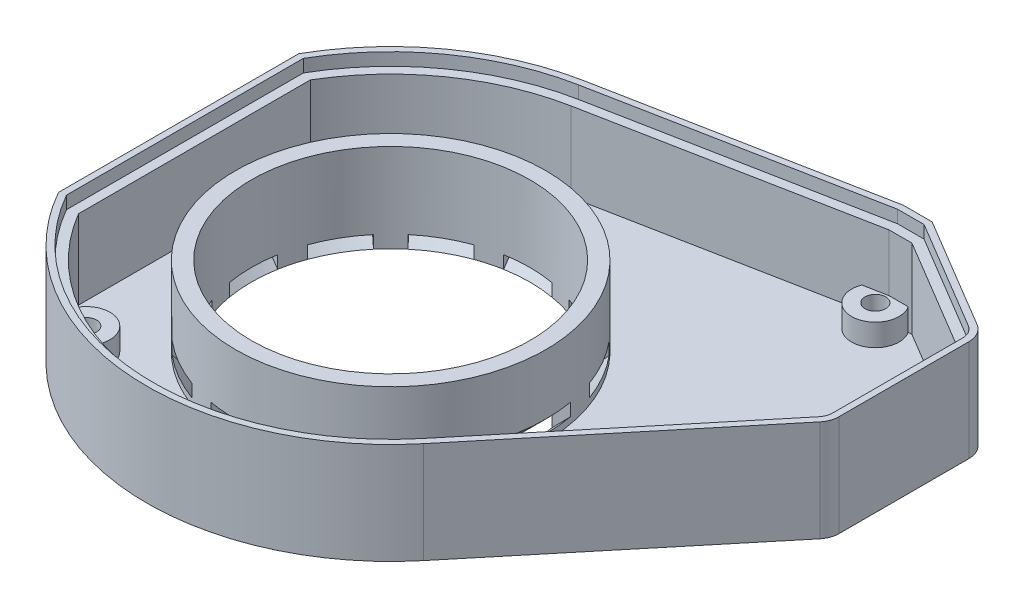
from build123d import *

# Parameters (mm, degrees)
SKETCH3_R                                         = 22
BOSS_EXTRUDE1_DEPTH                               = 1.5
BOSS_EXTRUDE2_DEPTH                               = 12.5
SKETCH5_R                                         = 24.5
SKETCH5_R_2                                       = 22
BOSS_EXTRUDE3_DEPTH                               = 12.5
BOSS_EXTRUDE5_DEPTH                               = 2
CUT_REVOLVE1_ANGLE                                = 20
CIRPATTERN1_COUNT                                 = 12
SKETCH12_R                                        = 3.75
BOSS_EXTRUDE6_DEPTH                               = 5
CSK_FOR_4_FLAT_HEAD_MACHINE_SCREW_100_D           = 3.2639
CSK_FOR_4_FLAT_HEAD_MACHINE_SCREW_100_CSINK_D     = 5.715
CSK_FOR_4_FLAT_HEAD_MACHINE_SCREW_100_CSINK_ANGLE = 100


# Read off the part's stored shape, not the designer's step: Cut-Revolve1
with BuildPart() as part:
    # Sketch3 → Boss-Extrude1 (new body)
    with BuildSketch(Plane(origin=(0, 0, 0), x_dir=(1, 0, 0), z_dir=(0, 1, 0))):
        with BuildLine():
            Line((39.523027355, 46), (34.965412665, 46))
            Line((34.965412665, 46), (-7.331355166, 37.795518669))
            ThreePointArc((-7.331355166, 37.795518669), (-22.480334206, 31.255152759), (-33.5, 18.973665961))
            Line((-33.5, 18.973665961), (-33.5, -18.973665961))
            ThreePointArc((-33.5, -18.973665961), (-3.369315914, -38.35228429), (29.67865128, -24.524022064))
            Line((29.67865128, -24.524022064), (58.016889207, 9.770543449))
            ThreePointArc((58.016889207, 9.770543449), (58.612248226, 10.815349677), (58.81883, 12))
            Line((58.81883, 12), (58.81883, 32.5))
            ThreePointArc((58.81883, 32.5), (58.362392683, 34.228214743), (57.112129316, 35.505674228))
            Line((57.112129316, 35.505674228), (39.523027355, 46))
        make_face()
        with Locations(Location((0, 0, 0), (0, 0, 270))):
            Circle(SKETCH3_R, mode=Mode.SUBTRACT)
    extrude(amount=BOSS_EXTRUDE1_DEPTH)

    # Sketch4 → Boss-Extrude2 (add)
    with BuildSketch(Plane(origin=(0, 1.5, 0), x_dir=(1, 0, 0), z_dir=(0, 1, 0))):
        with BuildLine():
            Line((57.112129316, 35.505674228), (39.523027355, 46))
            Line((39.523027355, 46), (34.965412665, 46))
            Line((34.965412665, 46), (-7.331355166, 37.795518669))
            ThreePointArc((-7.331355166, 37.795518669), (-22.480334206, 31.255152759), (-33.5, 18.973665961))
            Line((-33.5, 18.973665961), (-33.5, -18.973665961))
            ThreePointArc((-33.5, -18.973665961), (-3.369315914, -38.35228429), (29.67865128, -24.524022064))
            Line((29.67865128, -24.524022064), (58.016889207, 9.770543449))
            ThreePointArc((58.016889207, 9.770543449), (58.612248226, 10.815349677), (58.81883, 12))
            Line((58.81883, 12), (58.81883, 32.5))
            ThreePointArc((58.81883, 32.5), (58.362392683, 34.228214743), (57.112129316, 35.505674228))
        make_face()
        with BuildLine():
            Line((55.831201233, 33.358764065), (38.83389843, 43.5))
            Line((38.83389843, 43.5), (35.205641557, 43.5))
            Line((35.205641557, 43.5), (-6.855293142, 35.34126421))
            ThreePointArc((-6.855293142, 35.34126421), (-20.756477834, 29.413748961), (-31, 18.303005218))
            Line((-31, 18.303005218), (-31, -18.303005218))
            ThreePointArc((-31, -18.303005218), (-2.827385178, -35.888798992), (27.751466132, -22.931553099))
            Line((27.751466132, -22.931553099), (56.089704059, 11.363012414))
            ThreePointArc((56.089704059, 11.363012414), (56.259806636, 11.661528479), (56.31883, 12))
            Line((56.31883, 12), (56.31883, 32.5))
            ThreePointArc((56.31883, 32.5), (56.188419338, 32.993775641), (55.831201233, 33.358764065))
        make_face(mode=Mode.SUBTRACT)
    extrude(amount=BOSS_EXTRUDE2_DEPTH)

    # Sketch5 → Boss-Extrude3 (add)
    with BuildSketch(Plane(origin=(0, 1.5, 0), x_dir=(1, 0, 0), z_dir=(0, 1, 0))):
        with Locations(Location((0, 0, 0), (0, 0, 270))):
            Circle(SKETCH5_R)
        with Locations(Location((0, 0, 0), (0, 0, 270))):
            Circle(SKETCH5_R_2, mode=Mode.SUBTRACT)
    extrude(amount=BOSS_EXTRUDE3_DEPTH)

    # Sketch8 → Boss-Extrude5 (add)
    with BuildSketch(Plane(origin=(0, 14, 0), x_dir=(1, 0, 0), z_dir=(0, 1, 0))):
        with BuildLine():
            Line((57.112129316, 35.505674228), (39.523027355, 46))
            Line((39.523027355, 46), (34.965412665, 46))
            Line((34.965412665, 46), (-7.331355166, 37.795518669))
            ThreePointArc((-7.331355166, 37.795518669), (-22.480334206, 31.255152759), (-33.5, 18.973665961))
            Line((-33.5, 18.973665961), (-33.5, -18.973665961))
            ThreePointArc((-33.5, -18.973665961), (-3.369315914, -38.35228429), (29.67865128, -24.524022064))
            Line((29.67865128, -24.524022064), (58.016889207, 9.770543449))
            ThreePointArc((58.016889207, 9.770543449), (58.612248226, 10.815349677), (58.81883, 12))
            Line((58.81883, 12), (58.81883, 32.5))
            ThreePointArc((58.81883, 32.5), (58.362392683, 34.228214743), (57.112129316, 35.505674228))
        make_face()
        with BuildLine():
            Line((35.061504222, 45), (-7.140930356, 36.813816885))
            ThreePointArc((-7.140930356, 36.813816885), (-21.78998379, 30.519610194), (-32.5, 18.708286934))
            Line((-32.5, 18.708286934), (-32.5, -18.708286934))
            ThreePointArc((-32.5, -18.708286934), (-3.151328713, -37.367353764), (28.907777221, -23.887034478))
            Line((28.907777221, -23.887034478), (57.246015148, 10.407531035))
            ThreePointArc((57.246015148, 10.407531035), (57.67127159, 11.153821198), (57.81883, 12))
            Line((57.81883, 12), (57.81883, 32.5))
            ThreePointArc((57.81883, 32.5), (57.492803345, 33.734439102), (56.599758083, 34.646910163))
            Line((56.599758083, 34.646910163), (39.247375785, 45))
            Line((39.247375785, 45), (35.061504222, 45))
        make_face(mode=Mode.SUBTRACT)
    extrude(amount=BOSS_EXTRUDE5_DEPTH)

    # Cut-Revolve1 outline → Cut-Revolve1 (revolve, cut)
    with BuildSketch(Plane(origin=(0, 0, 0), x_dir=(0.984807753012208, 0, 0.17364817766693078), z_dir=(-0.17364817766693078, 0, 0.984807753012208))):
        Polygon((22, 2), (22, 0), (24.5, 2.5), (24.5, 4.5), align=None)
    cut_revolve1 = revolve(axis=Axis((0, 0, 0), (0, 1, 0)), revolution_arc=CUT_REVOLVE1_ANGLE, mode=Mode.SUBTRACT)

    # CirPattern1: Cut-Revolve1 ×12 about axis
    cirpattern1_axis = Axis((0, 0, 0), (0, 1, 0))
    for i in range(1, CIRPATTERN1_COUNT):
        add(cut_revolve1.rotate(cirpattern1_axis, i * 360 / CIRPATTERN1_COUNT), mode=Mode.SUBTRACT)

    # Sketch12 → Boss-Extrude6 (add)
    with BuildSketch(Plane(origin=(0, 0, 0), x_dir=(1, 0, 0), z_dir=(0, 1, 0))):
        with Locations((-24.04163056, 24.04163056)):
            Circle(SKETCH12_R)
        with Locations((-24.04163056, -24.04163056)):
            Circle(SKETCH12_R)
        with Locations((24.04163056, -24.04163056)):
            Circle(SKETCH12_R)
        with Locations((47.21419, 3.761759805)):
            Circle(SKETCH12_R)
        with Locations((35.10955, 41.444082154)):
            Circle(SKETCH12_R)
    extrude(amount=BOSS_EXTRUDE6_DEPTH)

    # CSK for #4 Flat Head Machine Screw (100)1 (through all)
    with Locations(Plane(origin=(0, 0, 0), x_dir=(-1, 0, 0), z_dir=(0, -1, 0))):
        with Locations((-35.10955, 41.444082154), (-47.21419, 3.761759805), (-24.04163056, -24.04163056), (24.04163056, -24.04163056), (24.04163056, 24.04163056)):
            CounterSinkHole(CSK_FOR_4_FLAT_HEAD_MACHINE_SCREW_100_D / 2, CSK_FOR_4_FLAT_HEAD_MACHINE_SCREW_100_CSINK_D / 2, counter_sink_angle=CSK_FOR_4_FLAT_HEAD_MACHINE_SCREW_100_CSINK_ANGLE)


solid = part.part
